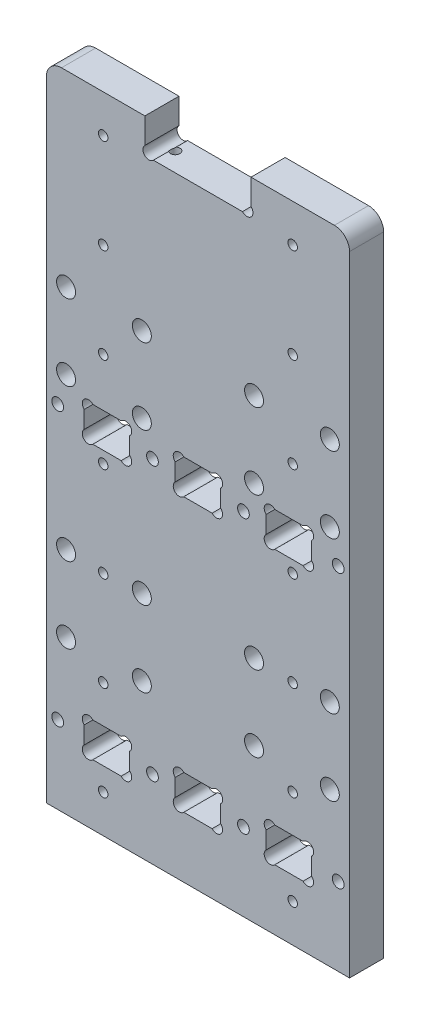
from build123d import *

# Parameters (mm, degrees)
ESQUISSE1_W                  = 80
ESQUISSE1_H                  = 170
BOSS_EXTRU_1_DEPTH           = 9
ESQUISSE2_R                  = 1.25
ENL_V_MAT_EXTRU_1_DEPTH      = 189.098378515
ESQUISSE4_W                  = 28
ESQUISSE4_H                  = 9
ENL_V_MAT_EXTRU_3_DEPTH      = 189.098378515
ESQUISSE5_R                  = 1.25
ENL_V_MAT_EXTRU_4_DEPTH      = 10
ESQUISSE6_R                  = 2.5
ENL_V_MAT_EXTRU_5_DEPTH      = 189.098378515
CONG_1_R                     = 4
ESQUISSE7_W                  = 12
ESQUISSE7_H                  = 9.1
ENL_V_MAT_EXTRU_6_DEPTH      = 189.098378515
ESQUISSE8_R                  = 1.6
ENL_V_MAT_EXTRU_7_DEPTH      = 189.098378515
ENL_V_MAT_EXTRU_8_DEPTH      = 189.09837852
ENL_V_MAT_EXTRU_8_DEPTH_BACK = 189.09837852
ESQUISSE9_R                  = 1.55


with BuildPart() as part:
    # Esquisse1 → Boss.-Extru.1 (new body)
    with BuildSketch(Plane.XY):
        with Locations((40, 85)):
            Rectangle(ESQUISSE1_W, ESQUISSE1_H)
    extrude(amount=BOSS_EXTRU_1_DEPTH)

    # Esquisse2 → Enlèv. mat.-Extru.1 (cut, through all)
    with BuildSketch(Plane.XY.offset(9)):
        with Locations((15, 10)):
            Circle(ESQUISSE2_R)
        with Locations((65, 10)):
            Circle(ESQUISSE2_R)
        with Locations((15, 35)):
            Circle(ESQUISSE2_R)
        with Locations((65, 35)):
            Circle(ESQUISSE2_R)
        with Locations((15, 60)):
            Circle(ESQUISSE2_R)
        with Locations((65, 60)):
            Circle(ESQUISSE2_R)
        with Locations((15, 85)):
            Circle(ESQUISSE2_R)
        with Locations((65, 85)):
            Circle(ESQUISSE2_R)
        with Locations((15, 110)):
            Circle(ESQUISSE2_R)
        with Locations((65, 110)):
            Circle(ESQUISSE2_R)
        with Locations((15, 135)):
            Circle(ESQUISSE2_R)
        with Locations((65, 135)):
            Circle(ESQUISSE2_R)
        with Locations((15, 160)):
            Circle(ESQUISSE2_R)
        with Locations((65, 160)):
            Circle(ESQUISSE2_R)
        with Locations((15, 185)):
            Circle(ESQUISSE2_R)
        with Locations((65, 185)):
            Circle(ESQUISSE2_R)
    extrude(amount=-ENL_V_MAT_EXTRU_1_DEPTH, mode=Mode.SUBTRACT)

    # Esquisse4 → Enlèv. mat.-Extru.3 (cut, through all)
    with BuildSketch(Plane.XY.offset(9)):
        with Locations((40, 165.5)):
            Rectangle(ESQUISSE4_W, ESQUISSE4_H)
    extrude(amount=-ENL_V_MAT_EXTRU_3_DEPTH, mode=Mode.SUBTRACT)

    # Esquisse5 → Enlèv. mat.-Extru.4 (cut)
    with BuildSketch(Plane(origin=(0, 161, 0), x_dir=(1, 0, 0), z_dir=(0, 1, 0))):
        with Locations((29, -4)):
            Circle(ESQUISSE5_R)
        with Locations((51, -4)):
            Circle(ESQUISSE5_R)
    extrude(amount=-ENL_V_MAT_EXTRU_4_DEPTH, mode=Mode.SUBTRACT)

    # Esquisse6 → Enlèv. mat.-Extru.5 (cut, through all)
    with BuildSketch(Plane.XY.offset(9)):
        with Locations((74.8, 120.5)):
            Circle(ESQUISSE6_R)
        with Locations((74.8, 60.5)):
            Circle(ESQUISSE6_R)
        with Locations((74.8, 100.5)):
            Circle(ESQUISSE6_R)
        with Locations((74.8, 40.5)):
            Circle(ESQUISSE6_R)
        with Locations((5.2, 40.5)):
            Circle(ESQUISSE6_R)
        with Locations((5.2, 100.5)):
            Circle(ESQUISSE6_R)
        with Locations((5.2, 60.5)):
            Circle(ESQUISSE6_R)
        with Locations((5.2, 120.5)):
            Circle(ESQUISSE6_R)
        with Locations((54.8, 100.5)):
            Circle(ESQUISSE6_R)
        with Locations((54.8, 120.5)):
            Circle(ESQUISSE6_R)
        with Locations((54.8, 40.5)):
            Circle(ESQUISSE6_R)
        with Locations((54.8, 60.5)):
            Circle(ESQUISSE6_R)
        with Locations((25.2, 60.5)):
            Circle(ESQUISSE6_R)
        with Locations((25.2, 40.5)):
            Circle(ESQUISSE6_R)
        with Locations((25.2, 120.5)):
            Circle(ESQUISSE6_R)
        with Locations((25.2, 100.5)):
            Circle(ESQUISSE6_R)
    extrude(amount=-ENL_V_MAT_EXTRU_5_DEPTH, mode=Mode.SUBTRACT)

    # Congé1
    cong_1_edges = [part.edges().sort_by_distance(p)[0] for p in [
        (80, 170, 4.5),
        (0, 170, 4.5),
    ]]
    fillet(cong_1_edges, radius=CONG_1_R)

    # Esquisse7 → Enlèv. mat.-Extru.6 (cut, through all)
    with BuildSketch(Plane.XY.offset(9)):
        with Locations((16, 20.55)):
            Rectangle(ESQUISSE7_W, ESQUISSE7_H)
        with Locations((40, 20.55)):
            Rectangle(ESQUISSE7_W, ESQUISSE7_H)
        with Locations((64, 20.55)):
            Rectangle(ESQUISSE7_W, ESQUISSE7_H)
        with Locations((64, 92.65)):
            Rectangle(ESQUISSE7_W, ESQUISSE7_H)
        with Locations((40, 92.65)):
            Rectangle(ESQUISSE7_W, ESQUISSE7_H)
        with Locations((16, 92.65)):
            Rectangle(ESQUISSE7_W, ESQUISSE7_H)
    extrude(amount=-ENL_V_MAT_EXTRU_6_DEPTH, mode=Mode.SUBTRACT)

    # Esquisse8 → Enlèv. mat.-Extru.7 (cut, through all)
    with BuildSketch(Plane.XY.offset(9)):
        with Locations((11.080265456, 17.080265456)):
            Circle(ESQUISSE8_R)
        with Locations((11.080265456, 24.019734544)):
            Circle(ESQUISSE8_R)
        with Locations((20.919734544, 24.019734544)):
            Circle(ESQUISSE8_R)
        with Locations((20.919734544, 17.080265456)):
            Circle(ESQUISSE8_R)
        with Locations((35.080265456, 17.080265456)):
            Circle(ESQUISSE8_R)
        with Locations((35.080265456, 24.019734544)):
            Circle(ESQUISSE8_R)
        with Locations((44.919734544, 24.019734544)):
            Circle(ESQUISSE8_R)
        with Locations((44.919734544, 17.080265456)):
            Circle(ESQUISSE8_R)
        with Locations((59.080265456, 17.080265456)):
            Circle(ESQUISSE8_R)
        with Locations((59.080265456, 24.019734544)):
            Circle(ESQUISSE8_R)
        with Locations((68.919734544, 24.019734544)):
            Circle(ESQUISSE8_R)
        with Locations((68.919734544, 17.080265456)):
            Circle(ESQUISSE8_R)
        with Locations((68.919734544, 96.119734544)):
            Circle(ESQUISSE8_R)
        with Locations((68.919734544, 89.180265456)):
            Circle(ESQUISSE8_R)
        with Locations((59.080265456, 89.180265456)):
            Circle(ESQUISSE8_R)
        with Locations((59.080265456, 96.119734544)):
            Circle(ESQUISSE8_R)
        with Locations((44.919734544, 96.119734544)):
            Circle(ESQUISSE8_R)
        with Locations((44.919734544, 89.180265456)):
            Circle(ESQUISSE8_R)
        with Locations((35.080265456, 89.180265456)):
            Circle(ESQUISSE8_R)
        with Locations((35.080265456, 96.119734544)):
            Circle(ESQUISSE8_R)
        with Locations((20.919734544, 96.119734544)):
            Circle(ESQUISSE8_R)
        with Locations((20.919734544, 89.180265456)):
            Circle(ESQUISSE8_R)
        with Locations((11.080265456, 89.180265456)):
            Circle(ESQUISSE8_R)
        with Locations((11.080265456, 96.119734544)):
            Circle(ESQUISSE8_R)
        with Locations((27.080265456, 162.080265456)):
            Circle(ESQUISSE8_R)
        with Locations((52.919734544, 162.080265456)):
            Circle(ESQUISSE8_R)
    extrude(amount=-ENL_V_MAT_EXTRU_7_DEPTH, mode=Mode.SUBTRACT)

    # Esquisse9 → Enlèv. mat.-Extru.8 (cut, two sides: drawn at the far end of the back side and taken through both)
    with BuildSketch(Plane.XY.offset(9).offset(-ENL_V_MAT_EXTRU_8_DEPTH_BACK)):
        with Locations((3, 92.65)):
            Circle(ESQUISSE9_R)
        with Locations((28, 92.65)):
            Circle(ESQUISSE9_R)
        with Locations((52, 92.65)):
            Circle(ESQUISSE9_R)
        with Locations((77, 92.65)):
            Circle(ESQUISSE9_R)
        with Locations((77, 20.55)):
            Circle(ESQUISSE9_R)
        with Locations((52, 20.55)):
            Circle(ESQUISSE9_R)
        with Locations((28, 20.55)):
            Circle(ESQUISSE9_R)
        with Locations((3, 20.55)):
            Circle(ESQUISSE9_R)
    extrude(amount=ENL_V_MAT_EXTRU_8_DEPTH + ENL_V_MAT_EXTRU_8_DEPTH_BACK, mode=Mode.SUBTRACT)


solid = part.part
